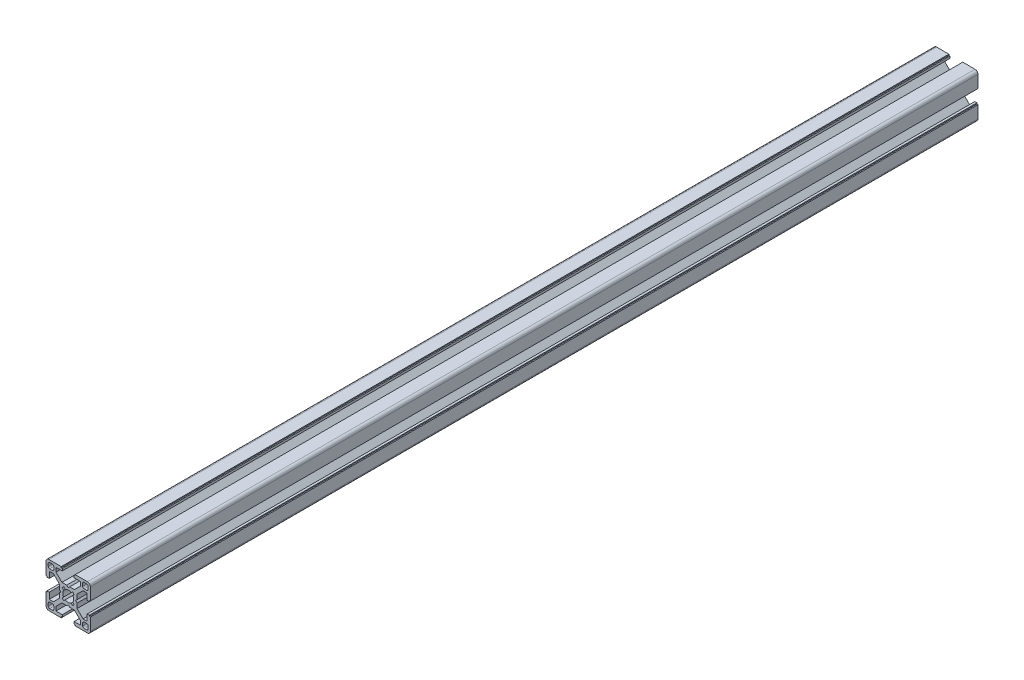
from build123d import *

# Parameters (mm, degrees)
ESTRUSIONE_ESTRUSIONE2_DEPTH = 600


with BuildPart() as part:
    # Schizzo1 → Estrusione-Estrusione2 (new body)
    with BuildSketch(Plane.XY):
        with BuildLine():
            ThreePointArc((-13, 15), (-14.414213562, 14.414213562), (-15, 13))
            Line((-15, 13), (-15, 4.7))
            Line((-15, 4.7), (-14.3, 4.7))
            Line((-14.3, 4.7), (-14.3, 4))
            Line((-14.3, 4), (-12.8, 4))
            Line((-12.8, 4), (-12.8, 8.25))
            Line((-12.8, 8.25), (-10.017766953, 8.25))
            Line((-10.017766953, 8.25), (-6, 4.232233047))
            Line((-6, 4.232233047), (-6, 1))
            Line((-6, 1), (-5, 0))
            Line((-5, 0), (-6, -1))
            Line((-6, -1), (-6, -4.232233047))
            Line((-6, -4.232233047), (-10.017766953, -8.25))
            Line((-10.017766953, -8.25), (-12.8, -8.25))
            Line((-12.8, -8.25), (-12.8, -4))
            Line((-12.8, -4), (-14.3, -4))
            Line((-14.3, -4), (-14.3, -4.7))
            Line((-14.3, -4.7), (-15, -4.7))
            Line((-15, -4.7), (-15, -13))
            ThreePointArc((-15, -13), (-14.414213562, -14.414213562), (-13, -15))
            Line((-13, -15), (-4.7, -15))
            Line((-4.7, -15), (-4.7, -14.3))
            Line((-4.7, -14.3), (-4, -14.3))
            Line((-4, -14.3), (-4, -12.8))
            Line((-4, -12.8), (-8.25, -12.8))
            Line((-8.25, -12.8), (-8.25, -10.017766953))
            Line((-8.25, -10.017766953), (-4.232233047, -6))
            Line((-4.232233047, -6), (-1, -6))
            Line((-1, -6), (0, -5))
            Line((0, -5), (1, -6))
            Line((1, -6), (4.232233047, -6))
            Line((4.232233047, -6), (8.25, -10.017766953))
            Line((8.25, -10.017766953), (8.25, -12.8))
            Line((8.25, -12.8), (4, -12.8))
            Line((4, -12.8), (4, -14.3))
            Line((4, -14.3), (4.7, -14.3))
            Line((4.7, -14.3), (4.7, -15))
            Line((4.7, -15), (13, -15))
            ThreePointArc((13, -15), (14.414213562, -14.414213562), (15, -13))
            Line((15, -13), (15, -4.7))
            Line((15, -4.7), (14.3, -4.7))
            Line((14.3, -4.7), (14.3, -4))
            Line((14.3, -4), (12.8, -4))
            Line((12.8, -4), (12.8, -8.25))
            Line((12.8, -8.25), (10.017766953, -8.25))
            Line((10.017766953, -8.25), (6, -4.232233047))
            Line((6, -4.232233047), (6, -1))
            Line((6, -1), (5, 0))
            Line((5, 0), (6, 1))
            Line((6, 1), (6, 4.232233047))
            Line((6, 4.232233047), (10.017766953, 8.25))
            Line((10.017766953, 8.25), (12.8, 8.25))
            Line((12.8, 8.25), (12.8, 4))
            Line((12.8, 4), (14.3, 4))
            Line((14.3, 4), (14.3, 4.7))
            Line((14.3, 4.7), (15, 4.7))
            Line((15, 4.7), (15, 13))
            ThreePointArc((15, 13), (14.414213562, 14.414213562), (13, 15))
            Line((13, 15), (4.7, 15))
            Line((4.7, 15), (4.7, 14.3))
            Line((4.7, 14.3), (4, 14.3))
            Line((4, 14.3), (4, 12.8))
            Line((4, 12.8), (8.25, 12.8))
            Line((8.25, 12.8), (8.25, 10.017766953))
            Line((8.25, 10.017766953), (4.232233047, 6))
            Line((4.232233047, 6), (1, 6))
            Line((1, 6), (0, 5))
            Line((0, 5), (-1, 6))
            Line((-1, 6), (-4.232233047, 6))
            Line((-4.232233047, 6), (-8.25, 10.017766953))
            Line((-8.25, 10.017766953), (-8.25, 12.8))
            Line((-8.25, 12.8), (-4, 12.8))
            Line((-4, 12.8), (-4, 14.3))
            Line((-4, 14.3), (-4.7, 14.3))
            Line((-4.7, 14.3), (-4.7, 15))
            Line((-4.7, 15), (-13, 15))
        make_face()
        with BuildLine():
            Line((-13.5, -12.5), (-13.5, -10.75))
            ThreePointArc((-13.5, -10.75), (-13.207106781, -10.042893219), (-12.5, -9.75))
            Line((-12.5, -9.75), (-10.75, -9.75))
            ThreePointArc((-10.75, -9.75), (-10.042893219, -10.042893219), (-9.75, -10.75))
            Line((-9.75, -10.75), (-9.75, -12.5))
            ThreePointArc((-9.75, -12.5), (-10.042893219, -13.207106781), (-10.75, -13.5))
            Line((-10.75, -13.5), (-12.5, -13.5))
            ThreePointArc((-12.5, -13.5), (-13.207106781, -13.207106781), (-13.5, -12.5))
        make_face(mode=Mode.SUBTRACT)
        with BuildLine():
            Line((12.5, -13.5), (10.75, -13.5))
            ThreePointArc((10.75, -13.5), (10.042893219, -13.207106781), (9.75, -12.5))
            Line((9.75, -12.5), (9.75, -10.75))
            ThreePointArc((9.75, -10.75), (10.042893219, -10.042893219), (10.75, -9.75))
            Line((10.75, -9.75), (12.5, -9.75))
            ThreePointArc((12.5, -9.75), (13.207106781, -10.042893219), (13.5, -10.75))
            Line((13.5, -10.75), (13.5, -12.5))
            ThreePointArc((13.5, -12.5), (13.207106781, -13.207106781), (12.5, -13.5))
        make_face(mode=Mode.SUBTRACT)
        with BuildLine():
            ThreePointArc((-9.75, 10.75), (-10.042893219, 10.042893219), (-10.75, 9.75))
            Line((-10.75, 9.75), (-12.5, 9.75))
            ThreePointArc((-12.5, 9.75), (-13.207106781, 10.042893219), (-13.5, 10.75))
            Line((-13.5, 10.75), (-13.5, 12.5))
            ThreePointArc((-13.5, 12.5), (-13.207106781, 13.207106781), (-12.5, 13.5))
            Line((-12.5, 13.5), (-10.75, 13.5))
            ThreePointArc((-10.75, 13.5), (-10.042893219, 13.207106781), (-9.75, 12.5))
            Line((-9.75, 12.5), (-9.75, 10.75))
        make_face(mode=Mode.SUBTRACT)
        with BuildLine():
            ThreePointArc((0, 3.65), (1.041005187, 3.498400806), (1.995536102, 3.056196274))
            Line((1.995536102, 3.056196274), (3.00520382, 4.065863992))
            Line((3.00520382, 4.065863992), (4.065863992, 3.00520382))
            Line((4.065863992, 3.00520382), (3.056196274, 1.995536102))
            ThreePointArc((3.056196274, 1.995536102), (3.498400806, 1.041005187), (3.65, 0))
            ThreePointArc((3.65, 0), (3.498400806, -1.041005187), (3.056196274, -1.995536102))
            Line((3.056196274, -1.995536102), (4.065863992, -3.00520382))
            Line((4.065863992, -3.00520382), (3.00520382, -4.065863992))
            Line((3.00520382, -4.065863992), (1.995536102, -3.056196274))
            ThreePointArc((1.995536102, -3.056196274), (1.041005187, -3.498400806), (0, -3.65))
            ThreePointArc((0, -3.65), (-1.041005187, -3.498400806), (-1.995536102, -3.056196274))
            Line((-1.995536102, -3.056196274), (-3.00520382, -4.065863992))
            Line((-3.00520382, -4.065863992), (-4.065863992, -3.00520382))
            Line((-4.065863992, -3.00520382), (-3.056196274, -1.995536102))
            ThreePointArc((-3.056196274, -1.995536102), (-3.498400806, -1.041005187), (-3.65, 0))
            ThreePointArc((-3.65, 0), (-3.498400806, 1.041005187), (-3.056196274, 1.995536102))
            Line((-3.056196274, 1.995536102), (-4.065863992, 3.00520382))
            Line((-4.065863992, 3.00520382), (-3.00520382, 4.065863992))
            Line((-3.00520382, 4.065863992), (-1.995536102, 3.056196274))
            ThreePointArc((-1.995536102, 3.056196274), (-1.041005187, 3.498400806), (0, 3.65))
        make_face(mode=Mode.SUBTRACT)
        with BuildLine():
            Line((13.5, 12.5), (13.5, 10.75))
            ThreePointArc((13.5, 10.75), (13.207106781, 10.042893219), (12.5, 9.75))
            Line((12.5, 9.75), (10.75, 9.75))
            ThreePointArc((10.75, 9.75), (10.042893219, 10.042893219), (9.75, 10.75))
            Line((9.75, 10.75), (9.75, 12.5))
            ThreePointArc((9.75, 12.5), (10.042893219, 13.207106781), (10.75, 13.5))
            Line((10.75, 13.5), (12.5, 13.5))
            ThreePointArc((12.5, 13.5), (13.207106781, 13.207106781), (13.5, 12.5))
        make_face(mode=Mode.SUBTRACT)
    extrude(amount=ESTRUSIONE_ESTRUSIONE2_DEPTH)


solid = part.part
